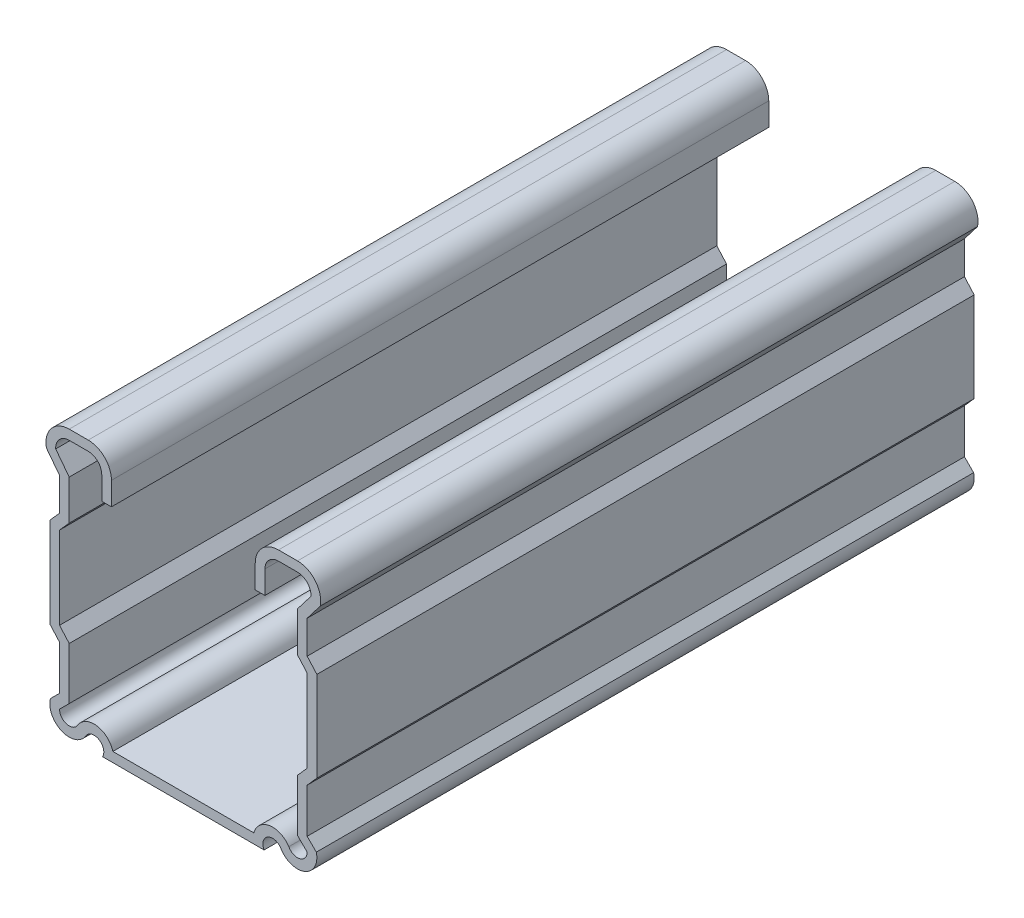
from build123d import *

# Parameters (mm, degrees)
BASE_EXTRUDE_DEPTH = 101.6
HOLE1_START        = -18.5166
HOLE1_OUTLINE_R    = 7.14375
HOLE1_DEPTH        = 1.4986
LPATTERN2_COUNT    = 2
LPATTERN2_PITCH    = 47.625


# Read off the part's stored shape, not the designer's step: Hole1
with BuildPart() as part:
    # Sketch1 → Base-Extrude (new body)
    with BuildSketch(Plane.XY):
        with BuildLine():
            Line((17.6403, 16.339286512), (19.729882578, 19.063533504))
            ThreePointArc((19.729882578, 19.063533504), (19.156045845, 20.609744632), (17.6403, 21.2598))
            Line((17.6403, 21.2598), (14.70327367, 21.2598))
            ThreePointArc((14.70327367, 21.2598), (13.223883481, 20.647016519), (12.6111, 19.16762633))
            Line((12.6111, 19.16762633), (12.6111, 15.61465))
            Line((12.6111, 15.61465), (11.1125, 15.61465))
            Line((11.1125, 15.61465), (11.1125, 19.16762633))
            ThreePointArc((11.1125, 19.16762633), (12.164213258, 21.706686742), (14.70327367, 22.7584))
            Line((14.70327367, 22.7584), (17.6403, 22.7584))
            ThreePointArc((17.6403, 22.7584), (20.415434554, 21.446284653), (21.162428673, 18.4688666))
            Line((21.162428673, 18.4688666), (19.1389, 15.830735923))
            Line((19.1389, 15.830735923), (19.1389, 10.749129415))
            Line((19.1389, 10.749129415), (20.6375, 9.0662125))
            Line((20.6375, 9.0662125), (20.6375, -4.8244125))
            Line((20.6375, -4.8244125), (19.1389, -6.507329415))
            Line((19.1389, -6.507329415), (19.1389, -13.358784555))
            Line((19.1389, -13.358784555), (20.553458003, -14.773342558))
            ThreePointArc((20.553458003, -14.773342558), (18.729942105, -18.270236732), (15.019825564, -16.932883251))
            ThreePointArc((15.019825564, -16.932883251), (13.000752562, -16.523120627), (12.480559153, -18.5166))
            Line((12.480559153, -18.5166), (-12.480559153, -18.5166))
            ThreePointArc((-12.480559153, -18.5166), (-13.000752562, -16.523120627), (-15.019825564, -16.932883251))
            ThreePointArc((-15.019825564, -16.932883251), (-18.729942105, -18.270236732), (-20.553458003, -14.773342558))
            Line((-20.553458003, -14.773342558), (-19.1389, -13.358784555))
            Line((-19.1389, -13.358784555), (-19.1389, -6.507329415))
            Line((-19.1389, -6.507329415), (-20.6375, -4.8244125))
            Line((-20.6375, -4.8244125), (-20.6375, 9.0662125))
            Line((-20.6375, 9.0662125), (-19.1389, 10.749129415))
            Line((-19.1389, 10.749129415), (-19.1389, 15.830735923))
            Line((-19.1389, 15.830735923), (-21.162428673, 18.4688666))
            ThreePointArc((-21.162428673, 18.4688666), (-20.415434554, 21.446284653), (-17.6403, 22.7584))
            Line((-17.6403, 22.7584), (-14.70327367, 22.7584))
            ThreePointArc((-14.70327367, 22.7584), (-12.164213258, 21.706686742), (-11.1125, 19.16762633))
            Line((-11.1125, 19.16762633), (-11.1125, 15.61465))
            Line((-11.1125, 15.61465), (-12.6111, 15.61465))
            Line((-12.6111, 15.61465), (-12.6111, 19.16762633))
            ThreePointArc((-12.6111, 19.16762633), (-13.223883481, 20.647016519), (-14.70327367, 21.2598))
            Line((-14.70327367, 21.2598), (-17.6403, 21.2598))
            ThreePointArc((-17.6403, 21.2598), (-19.156045845, 20.609744632), (-19.729882578, 19.063533504))
            Line((-19.729882578, 19.063533504), (-17.6403, 16.339286512))
            Line((-17.6403, 16.339286512), (-17.6403, 10.17860201))
            Line((-17.6403, 10.17860201), (-19.1389, 8.495685095))
            Line((-19.1389, 8.495685095), (-19.1389, -4.253885095))
            Line((-19.1389, -4.253885095), (-17.6403, -5.93680201))
            Line((-17.6403, -5.93680201), (-17.6403, -13.979525))
            Line((-17.6403, -13.979525), (-19.1389, -15.478125))
            ThreePointArc((-19.1389, -15.478125), (-18.092238669, -16.906954381), (-16.414285827, -16.33992034))
            ThreePointArc((-16.414285827, -16.33992034), (-13.428073412, -14.819877156), (-10.898992189, -17.018))
            Line((-10.898992189, -17.018), (10.898992189, -17.018))
            ThreePointArc((10.898992189, -17.018), (13.323359075, -14.834630878), (16.30518861, -16.15877141))
            ThreePointArc((16.30518861, -16.15877141), (17.990302879, -16.935279743), (19.1389, -15.478125))
            Line((19.1389, -15.478125), (17.6403, -13.979525))
            Line((17.6403, -13.979525), (17.6403, -5.93680201))
            Line((17.6403, -5.93680201), (19.1389, -4.253885095))
            Line((19.1389, -4.253885095), (19.1389, 8.495685095))
            Line((19.1389, 8.495685095), (17.6403, 10.17860201))
            Line((17.6403, 10.17860201), (17.6403, 16.339286512))
        make_face()
    extrude(amount=BASE_EXTRUDE_DEPTH)

    # Hole1 outline → Hole1 (cut)
    with BuildSketch(Plane(origin=(0, 0, 0), x_dir=(1, 0, 0), z_dir=(0, 1, 0)).offset(HOLE1_START)):
        with Locations((0, -23.8125)):
            Circle(HOLE1_OUTLINE_R)
    hole1 = extrude(amount=HOLE1_DEPTH, mode=Mode.SUBTRACT)

    # LPattern2: Hole1 ×2
    with Locations(*[(0, 0, i * LPATTERN2_PITCH) for i in range(1, LPATTERN2_COUNT)]):
        add(hole1, mode=Mode.SUBTRACT)


solid = part.part
